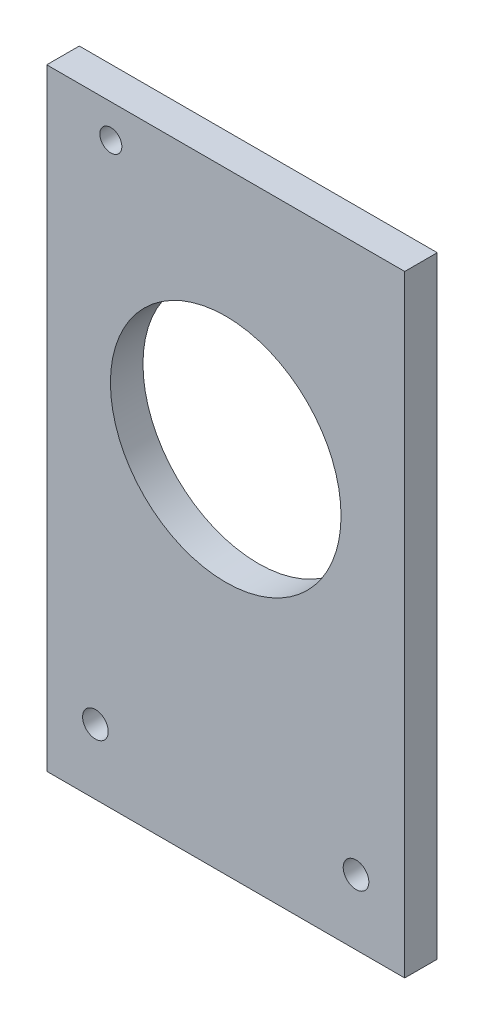
from build123d import *

# Parameters (mm, degrees)
SKETCH2_R               = 22.5
BOSS_EXTRUDE1_DEPTH     = 3.175
CUT_EXTRUDE1_DEPTH      = 125.564995585
CUT_EXTRUDE1_DEPTH_BACK = 125.564995585
SKETCH3_R               = 2.5
SKETCH3_R_2             = 2.15


with BuildPart() as part:
    # Sketch2 → Boss-Extrude1 (new, symmetric)
    with BuildSketch(Plane.XY):
        Polygon((-34.925, 0), (34.925, 0), (34.925, 71.9), (34.925, 104.4), (34.925, 119.4), (-34.925, 119.4), (-34.925, 104.4), (-34.925, 71.9), align=None)
        with Locations((0, 71.9)):
            Circle(SKETCH2_R, mode=Mode.SUBTRACT)
    extrude(amount=BOSS_EXTRUDE1_DEPTH, both=True)

    # Sketch3 → Cut-Extrude1 (cut, two sides: drawn at the far end of the back side and taken through both)
    with BuildSketch(Plane.XY.offset(3.175).offset(-CUT_EXTRUDE1_DEPTH_BACK)):
        with Locations((-25.425, 12.7)):
            Circle(SKETCH3_R)
        with Locations((25.425, 12.7)):
            Circle(SKETCH3_R)
        with Locations((-22.425, 112.9)):
            Circle(SKETCH3_R_2)
    extrude(amount=CUT_EXTRUDE1_DEPTH + CUT_EXTRUDE1_DEPTH_BACK, mode=Mode.SUBTRACT)


solid = part.part
